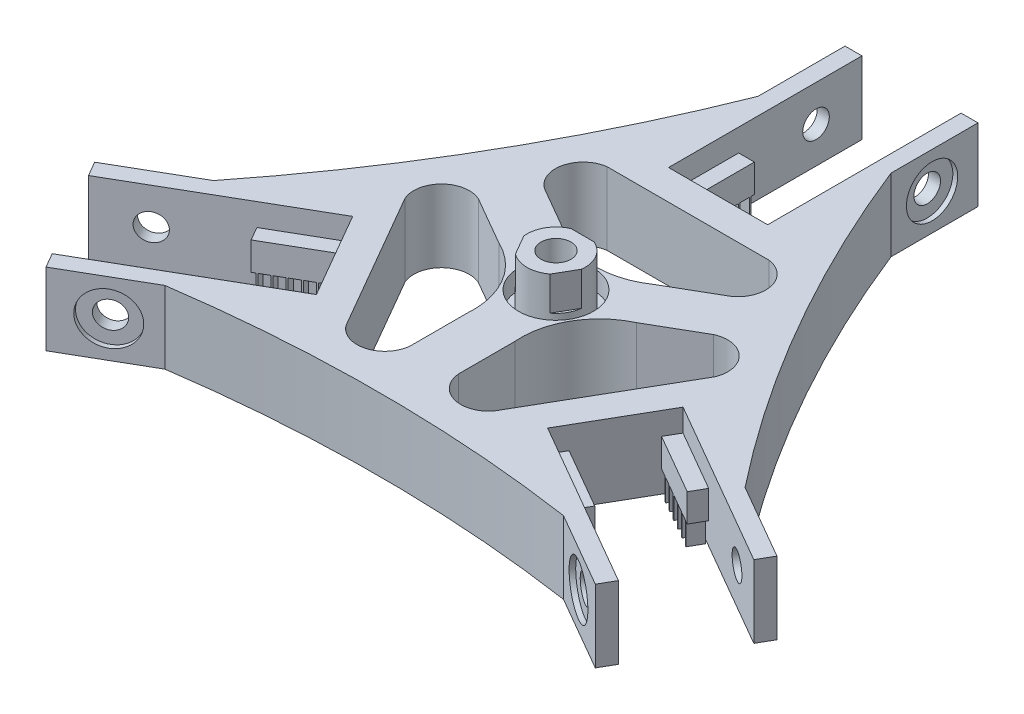
from build123d import *
from OCP.BRepAlgoAPI import BRepAlgoAPI_Cut
from OCP.TopTools import TopTools_ListOfShape

# Parameters (mm, degrees)
BOSS_EXTRUDE1_DEPTH          = 15
CUT_EXTRUDE2_DEPTH           = 38
SKETCH10_W                   = 20.5
SKETCH10_H                   = 27.012323029
CUT_EXTRUDE3_DEPTH           = 40
SKETCH15_R                   = 2.75
CUT_EXTRUDE5_DEPTH           = 40
SKETCH16_R                   = 5.3
CUT_EXTRUDE6_DEPTH           = 40
CIRPATTERN3_COUNT            = 3
CIRPATTERN3_COPY_1_SKETCH_R  = 5.3
CIRPATTERN3_COPY_1_DEPTH     = 40
CIRPATTERN3_COPY_2_SKETCH_R  = 5.3
CIRPATTERN3_COPY_2_DEPTH     = 40
CUT_EXTRUDE7_DEPTH           = 15
SKETCH21_R                   = 3.1
CUT_EXTRUDE8_DEPTH           = 40
BOSS_EXTRUDE2_DEPTH          = 7
CUT_EXTRUDE13_START          = -15
SKETCH27_R                   = 3.1
CUT_EXTRUDE13_DEPTH          = 15
ESQUISSE7_W                  = 2.95
ESQUISSE7_H                  = 0.3
BOSS_EXTRU_9_DEPTH           = 4.55
ESQUISSE8_W                  = 3.50000073
ESQUISSE8_H                  = 2
ESQUISSE8_W_2                = 3.5
BOSS_EXTRU_10_DEPTH          = 15
R_P_TITION_CIRCULAIRE2_DEPTH = 15
ENL_V_START                  = -4
ESQUISSE15_R                 = 7.75
ESQUISSE15_R_2               = 6
ENL_V_MAT_EXTRU_1_DEPTH      = 4
BOSS_EXTRU_11_DEPTH          = 15
ENL_V_START_2                = -15
ENL_V_MAT_EXTRU_2_DEPTH      = 15


with BuildPart() as part:
    # Sketch1 → Boss-Extrude1 (new body)
    with BuildSketch(Plane(origin=(0, 0, 0), x_dir=(1, 0, 0), z_dir=(0, 1, 0))):
        Polygon((-21.797006273, 71.528511607), (-72.844011657, -16.887495292), (-51.047006273, -54.64101607), (51.047004495, -54.64101607), (72.844009878, -16.887495292), (21.797004495, 71.528511607), align=None)
    extrude(amount=BOSS_EXTRUDE1_DEPTH)

    # Sketch5 → Cut-Extrude2 (cut)
    with BuildSketch(Plane(origin=(0, 0, -71.528511607), x_dir=(-1, 0, 0), z_dir=(0, 0, -1))):
        Polygon((7.000000889, 10.35), (10.250000889, 10.35), (10.250000889, 16.19707375), (-10.249999111, 16.19707375), (-10.249999111, 10.35), (-6.999999111, 10.35), (-6.999999111, 4.55), (-10.249999111, 4.55), (-10.249999111, -0.875434666), (10.250000889, -0.875434666), (10.250000889, 4.55), (7.000000889, 4.55), align=None)
    cut_extrude2 = extrude(amount=-CUT_EXTRUDE2_DEPTH, mode=Mode.SUBTRACT)

    # Sketch10 → Cut-Extrude3 (cut)
    with BuildSketch(Plane(origin=(0, 15, 0), x_dir=(1, 0, 0), z_dir=(0, 1, 0))):
        with Locations((-8.89e-07, 61.534673122)):
            Rectangle(SKETCH10_W, SKETCH10_H)
    cut_extrude3 = extrude(amount=-CUT_EXTRUDE3_DEPTH, mode=Mode.SUBTRACT)

    # Sketch15 → Cut-Extrude5 (cut, symmetric)
    with BuildSketch(Plane(origin=(-10.250000889, 0, 0), x_dir=(0, 0, -1), z_dir=(1, 0, 0))):
        with Locations(Location((64.028511607, 7.5, 0), (0, 0, 90))):
            Circle(SKETCH15_R)
    cut_extrude5 = extrude(amount=CUT_EXTRUDE5_DEPTH, both=True, mode=Mode.SUBTRACT)

    # Sketch16 → Cut-Extrude6 (cut)
    with BuildSketch(Plane(origin=(-12.750000889, 0, 0), x_dir=(0, 0, -1), z_dir=(1, 0, 0))):
        with Locations((64.028511607, 7.5)):
            Circle(SKETCH16_R)
    cut_extrude6 = extrude(amount=-CUT_EXTRUDE6_DEPTH, mode=Mode.SUBTRACT)

    # Mirror1: Cut-Extrude6 across plane
    add(cut_extrude6.mirror(Plane(origin=(0, 0, 0), x_dir=(0, 0, 1), z_dir=(1, 0, 0))), mode=Mode.SUBTRACT)

    # CirPattern3: Cut-Extrude2, Cut-Extrude3, Cut-Extrude5, Cut-Extrude6 ×3 about axis
    cirpattern3_axis = Axis((0, 0, 0), (0, 1, 0))
    add([cut_extrude2.rotate(cirpattern3_axis, i * 360 / CIRPATTERN3_COUNT) for i in range(1, CIRPATTERN3_COUNT)], mode=Mode.SUBTRACT)
    add([cut_extrude3.rotate(cirpattern3_axis, i * 360 / CIRPATTERN3_COUNT) for i in range(1, CIRPATTERN3_COUNT)], mode=Mode.SUBTRACT)
    add([cut_extrude5.rotate(cirpattern3_axis, i * 360 / CIRPATTERN3_COUNT) for i in range(1, CIRPATTERN3_COUNT)], mode=Mode.SUBTRACT)
    add([cut_extrude6.rotate(cirpattern3_axis, i * 360 / CIRPATTERN3_COUNT) for i in range(1, CIRPATTERN3_COUNT)], mode=Mode.SUBTRACT)

    # CirPattern3 copy 1 sketch → CirPattern3 copy 1 (cut)
    with BuildSketch(Plane(origin=(-6.375000445, 0, -11.041824668), x_dir=(-0.8660254037844387, 0, 0.4999999999999998), z_dir=(0.4999999999999998, 0, 0.8660254037844387))):
        with Locations((64.028511607, -7.5)):
            Circle(CIRPATTERN3_COPY_1_SKETCH_R)
    extrude(amount=-CIRPATTERN3_COPY_1_DEPTH, mode=Mode.SUBTRACT)

    # CirPattern3 copy 2 sketch → CirPattern3 copy 2 (cut)
    with BuildSketch(Plane(origin=(-6.375000445, 0, 11.041824668), x_dir=(0.8660254037844384, 0, 0.5000000000000004), z_dir=(0.5000000000000004, 0, -0.8660254037844384))):
        with Locations((64.028511607, -7.5)):
            Circle(CIRPATTERN3_COPY_2_SKETCH_R)
    extrude(amount=-CIRPATTERN3_COPY_2_DEPTH, mode=Mode.SUBTRACT)

    # Sketch20 → Cut-Extrude7 (cut)
    with BuildSketch(Plane(origin=(0, 15, 0), x_dir=(1, 0, 0), z_dir=(0, 1, 0))):
        with BuildLine():
            Line((92.688017182, -6.554453562), (68.820508591, -23.856405731))
            Line((68.820508591, -23.856405731), (51.500000515, -13.856405731))
            ThreePointArc((51.500000515, -13.856405731), (26.977145445, 15.575262652), (13.749999111, 51.528511803))
            Line((13.749999111, 51.528511803), (13.749999111, 71.528511803))
            Line((13.749999111, 71.528511803), (65.825359206, 76.180863169))
            Line((65.825359206, 76.180863169), (92.688017182, -6.554453562))
        make_face()
        with BuildLine():
            Line((-68.820507872, -23.85640737), (-98.887242389, 18.916001701))
            Line((-98.887242389, 18.916001701), (-40.667685298, 83.547404286))
            Line((-40.667685298, 83.547404286), (-13.750000889, 71.528511607))
            Line((-13.750000889, 71.528511607), (-13.750000889, 51.528511607))
            ThreePointArc((-13.750000889, 51.528511607), (-26.97714585, 15.575261951), (-51.499999796, -13.85640737))
            Line((-51.499999796, -13.85640737), (-68.820507872, -23.85640737))
        make_face()
        with BuildLine():
            Line((-52.020331883, -76.992950725), (-55.070507702, -47.672105875))
            Line((-55.070507702, -47.672105875), (-37.749999626, -37.672105875))
            ThreePointArc((-37.749999626, -37.672105875), (4.05e-07, -31.150524603), (37.750000685, -37.672104433))
            Line((37.750000685, -37.672104433), (55.070508761, -47.672104433))
            Line((55.070508761, -47.672104433), (33.061883184, -95.09686487))
            Line((33.061883184, -95.09686487), (-52.020331883, -76.992950725))
        make_face()
    extrude(amount=-CUT_EXTRUDE7_DEPTH, mode=Mode.SUBTRACT)

    # Sketch21 → Cut-Extrude8 (cut)
    with BuildSketch(Plane(origin=(0, 15, 0), x_dir=(1, 0, 0), z_dir=(0, 1, 0))):
        with Locations(Location((0, 0, 0), (0, 0, 270))):
            Circle(SKETCH21_R)
    extrude(amount=-CUT_EXTRUDE8_DEPTH, mode=Mode.SUBTRACT)

    # Sketch26 → Boss-Extrude2 (add)
    with BuildSketch(Plane(origin=(0, 15, 0), x_dir=(1, 0, 0), z_dir=(0, 1, 0))):
        with BuildLine():
            Line((2.38344399, 5.506286838), (-2.38344399, 5.506286838))
            ThreePointArc((-2.38344399, 5.506286838), (-5.196152423, 3), (-5.960306278, -0.689020376))
            Line((-5.960306278, -0.689020376), (-3.576862288, -4.817266463))
            ThreePointArc((-3.576862288, -4.817266463), (0, -6), (3.576862288, -4.817266463))
            Line((3.576862288, -4.817266463), (5.960306278, -0.689020376))
            ThreePointArc((5.960306278, -0.689020376), (5.196152423, 3), (2.38344399, 5.506286838))
        make_face()
    extrude(amount=BOSS_EXTRUDE2_DEPTH)

    # Sketch27 → Cut-Extrude13 (cut)
    with BuildSketch(Plane.XZ.offset(-15).offset(CUT_EXTRUDE13_START)):
        with Locations(Location((0, 0, 0), (0, 0, 90))):
            Circle(SKETCH27_R)
    extrude(amount=CUT_EXTRUDE13_DEPTH, mode=Mode.SUBTRACT)

    # Esquisse7 → Boss.-Extru.9 (add)
    with BuildSketch(Plane.XZ.offset(-4.55)):
        with Locations((-8.475000889, -35.678511607)):
            Rectangle(ESQUISSE7_W, ESQUISSE7_H)
        with Locations((-8.475000889, -37.978511607)):
            Rectangle(ESQUISSE7_W, ESQUISSE7_H)
        with Locations((-8.475000889, -40.278511607)):
            Rectangle(ESQUISSE7_W, ESQUISSE7_H)
        with Locations((-8.475000889, -42.578511607)):
            Rectangle(ESQUISSE7_W, ESQUISSE7_H)
        with Locations((-8.475000889, -44.878511607)):
            Rectangle(ESQUISSE7_W, ESQUISSE7_H)
        with Locations((-8.475000889, -47.178511607)):
            Rectangle(ESQUISSE7_W, ESQUISSE7_H)
        with Locations((8.475000889, -47.178511607)):
            Rectangle(ESQUISSE7_W, ESQUISSE7_H)
        with Locations((8.475000889, -44.878511607)):
            Rectangle(ESQUISSE7_W, ESQUISSE7_H)
        with Locations((8.475000889, -42.578511607)):
            Rectangle(ESQUISSE7_W, ESQUISSE7_H)
        with Locations((8.475000889, -40.278511607)):
            Rectangle(ESQUISSE7_W, ESQUISSE7_H)
        with Locations((8.475000889, -37.978511607)):
            Rectangle(ESQUISSE7_W, ESQUISSE7_H)
        with Locations((8.475000889, -35.678511607)):
            Rectangle(ESQUISSE7_W, ESQUISSE7_H)
        Polygon((-25.793593165, 26.381209341), (-27.268593165, 23.8264344), (-27.528400786, 23.9764344), (-26.053400786, 26.531209341), align=None)
        Polygon((-27.785451594, 27.531209341), (-28.045259215, 27.681209341), (-29.520259215, 25.1264344), (-29.260451594, 24.9764344), align=None)
        Polygon((-29.777310023, 28.681209341), (-30.037117644, 28.831209341), (-31.512117644, 26.2764344), (-31.252310023, 26.1264344), align=None)
        Polygon((-31.769168451, 29.831209341), (-32.028976073, 29.981209341), (-33.503976073, 27.4264344), (-33.244168451, 27.2764344), align=None)
        Polygon((-33.76102688, 30.981209341), (-34.020834501, 31.131209341), (-35.495834501, 28.5764344), (-35.23602688, 28.4264344), align=None)
        Polygon((-35.752885309, 32.131209341), (-36.01269293, 32.281209341), (-37.48769293, 29.7264344), (-37.227885309, 29.5764344), align=None)
        Polygon((-44.227886198, 17.452077207), (-44.487693819, 17.602077207), (-45.962693819, 15.047302266), (-45.702886198, 14.897302266), align=None)
        Polygon((-42.236027769, 16.302077207), (-42.495835391, 16.452077207), (-43.970835391, 13.897302266), (-43.711027769, 13.747302266), align=None)
        Polygon((-40.244169341, 15.152077207), (-40.503976962, 15.302077207), (-41.978976962, 12.747302266), (-41.719169341, 12.597302266), align=None)
        Polygon((-38.252310912, 14.002077207), (-38.512118533, 14.152077207), (-39.987118533, 11.597302266), (-39.727310912, 11.447302266), align=None)
        Polygon((-36.260452483, 12.852077207), (-36.520260104, 13.002077207), (-37.995260104, 10.447302266), (-37.735452483, 10.297302266), align=None)
        Polygon((-34.268594055, 11.702077207), (-34.528401676, 11.852077207), (-36.003401676, 9.297302266), (-35.743594055, 9.147302266), align=None)
        Polygon((35.743594055, 9.147302266), (34.268594055, 11.702077207), (34.528401676, 11.852077207), (36.003401676, 9.297302266), align=None)
        Polygon((37.735452483, 10.297302266), (37.995260104, 10.447302266), (36.520260104, 13.002077207), (36.260452483, 12.852077207), align=None)
        Polygon((39.727310912, 11.447302266), (39.987118533, 11.597302266), (38.512118533, 14.152077207), (38.252310912, 14.002077207), align=None)
        Polygon((41.719169341, 12.597302266), (41.978976962, 12.747302266), (40.503976962, 15.302077207), (40.244169341, 15.152077207), align=None)
        Polygon((43.711027769, 13.747302266), (43.970835391, 13.897302266), (42.495835391, 16.452077207), (42.236027769, 16.302077207), align=None)
        Polygon((45.702886198, 14.897302266), (45.962693819, 15.047302266), (44.487693819, 17.602077207), (44.227886198, 17.452077207), align=None)
        Polygon((37.227885309, 29.5764344), (37.48769293, 29.7264344), (36.01269293, 32.281209341), (35.752885309, 32.131209341), align=None)
        Polygon((35.23602688, 28.4264344), (35.495834501, 28.5764344), (34.020834501, 31.131209341), (33.76102688, 30.981209341), align=None)
        Polygon((33.244168451, 27.2764344), (33.503976073, 27.4264344), (32.028976073, 29.981209341), (31.769168451, 29.831209341), align=None)
        Polygon((31.252310023, 26.1264344), (31.512117644, 26.2764344), (30.037117644, 28.831209341), (29.777310023, 28.681209341), align=None)
        Polygon((29.260451594, 24.9764344), (29.520259215, 25.1264344), (28.045259215, 27.681209341), (27.785451594, 27.531209341), align=None)
        Polygon((27.268593165, 23.8264344), (27.528400786, 23.9764344), (26.053400786, 26.531209341), (25.793593165, 26.381209341), align=None)
    extrude(amount=BOSS_EXTRU_9_DEPTH)

    # Esquisse8 → Boss.-Extru.10 (add)
    with BuildSketch(Plane(origin=(0, 15, 0), x_dir=(1, 0, 0), z_dir=(0, 1, 0))):
        with Locations((11.999998746, 72.528511803)):
            Rectangle(ESQUISSE8_W, ESQUISSE8_H)
        with Locations((-12.000000889, 72.528511607)):
            Rectangle(ESQUISSE8_W_2, ESQUISSE8_H)
    extrude(amount=-BOSS_EXTRU_10_DEPTH)


with BuildPart() as r_p_tition_circulaire2_tool:
    # Répétition circulaire2: read off the stored shape, not the designer's step
    # Répétition circulaire2 outline → Répétition circulaire2 (new body)
    with BuildSketch(Plane(origin=(0, 0, 0), x_dir=(1, 0, 0), z_dir=(0, 1, 0))):
        Polygon((-68.820508067, -23.856407483), (-70.552558679, -24.85640737), (-68.802558314, -27.887496915), (-67.070507982, -26.887496347), align=None)
        Polygon((-56.820507982, -44.641017124), (-58.552558509, -45.641016962), (-56.802558509, -48.672105875), (-55.070507982, -47.672106037), align=None)
        Polygon((55.070508289, -47.672104161), (56.802559568, -48.672104433), (58.552559934, -45.641014888), (56.820508204, -44.641015199), align=None)
        Polygon((67.070508204, -26.887494421), (68.802559398, -27.887494644), (70.552559398, -24.856405731), (68.820508204, -23.856405508), align=None)
    extrude(amount=R_P_TITION_CIRCULAIRE2_DEPTH)


with BuildPart() as part_1:
    add(part.part)


with BuildPart() as part_2:
    # Répétition circulaire2: joined with r_p_tition_circulaire2_tool
    add(part_1.part.fuse(r_p_tition_circulaire2_tool.part, tol=0.00001))

    # Esquisse15 → Enlèv. mat.-Extru.1 (cut)
    with BuildSketch(Plane(origin=(0, 15, 0), x_dir=(1, 0, 0), z_dir=(0, 1, 0)).offset(ENL_V_START)):
        with Locations(Location((0, 0, 0), (0, 0, 270))):
            Circle(ESQUISSE15_R)
        with Locations(Location((0, 0, 0), (0, 0, 66.594207935))):
            Circle(ESQUISSE15_R_2, mode=Mode.SUBTRACT)
    extrude(amount=ENL_V_MAT_EXTRU_1_DEPTH, mode=Mode.SUBTRACT)

    # Esquisse16 → Boss.-Extru.11 (add)
    with BuildSketch(Plane(origin=(0, 15, 0), x_dir=(1, 0, 0), z_dir=(0, 1, 0))):
        with BuildLine():
            ThreePointArc((13.749999111, 51.528511803), (26.977145445, 15.575262652), (51.500000515, -13.856405731))
            Line((51.500000515, -13.856405731), (54.964102245, -15.856405797))
            Line((54.964102245, -15.856405797), (13.749999111, 55.528511671))
            Line((13.749999111, 55.528511671), (13.749999111, 51.528511803))
        make_face()
        with BuildLine():
            Line((-13.750000889, 51.528511607), (-13.750000889, 55.528511739))
            Line((-13.750000889, 55.528511739), (-54.964101296, -15.856407303))
            Line((-54.964101296, -15.856407303), (-51.499999796, -13.85640737))
            ThreePointArc((-51.499999796, -13.85640737), (-26.97714585, 15.575261951), (-13.750000889, 51.528511607))
        make_face()
        with BuildLine():
            ThreePointArc((37.750000685, -37.672104433), (4.05e-07, -31.150524603), (-37.749999626, -37.672105875))
            Line((-37.749999626, -37.672105875), (-41.214101356, -39.672105942))
            Line((-41.214101356, -39.672105942), (41.214102186, -39.672104367))
            Line((41.214102186, -39.672104367), (37.750000685, -37.672104433))
        make_face()
    extrude(amount=-BOSS_EXTRU_11_DEPTH)


with BuildPart() as enl_v_mat_extru_2_tool:
    # Enlèv. mat.-Extru.2: read off the stored shape, not the designer's step
    # Enlèv. mat.-Extru.2 outline → Enlèv. mat.-Extru.2 (new body)
    with BuildSketch(Plane(origin=(0, 15, 0), x_dir=(1, 0, 0), z_dir=(0, 1, 0)).offset(ENL_V_START_2)):
        with BuildLine():
            Line((15.293738513, -28.153880503), (32.028844987, 0.83217418))
            ThreePointArc((32.028844987, 0.83217418), (30.704453712, 7.185917337), (24.303308362, 8.258019274))
            Line((24.303308362, 8.258019274), (14.211696643, 2.431624152))
            ThreePointArc((14.211696643, 2.431624152), (7.105848219, -4.102563382), (5.000000033, -13.5235024))
            Line((5.000000033, -13.5235024), (4.999999705, -25.176292075))
            ThreePointArc((4.999999705, -25.176292075), (9.129039893, -30.183795592), (15.293738513, -28.153880503))
        make_face()
        with BuildLine():
            Line((-32.028844987, 0.83217418), (-15.293738513, -28.153880503))
            ThreePointArc((-15.293738513, -28.153880503), (-9.129039893, -30.183795592), (-4.999999705, -25.176292075))
            Line((-4.999999705, -25.176292075), (-5.000000033, -13.5235024))
            ThreePointArc((-5.000000033, -13.5235024), (-7.105848219, -4.102563382), (-14.211696643, 2.431624152))
            Line((-14.211696643, 2.431624152), (-24.303308362, 8.258019274))
            ThreePointArc((-24.303308362, 8.258019274), (-30.704453712, 7.185917337), (-32.028844987, 0.83217418))
        make_face()
        with BuildLine():
            Line((-41.21410152, -39.672104818), (41.214104849, -39.672104404))
            ThreePointArc((41.214104849, -39.672104404), (1.649e-06, -36.672104404), (-41.21410152, -39.672104818))
        make_face()
        with BuildLine():
            Line((16.735106474, 27.321706323), (-16.735106474, 27.321706323))
            ThreePointArc((-16.735106474, 27.321706323), (-21.575413819, 22.997878256), (-19.303308658, 16.918272801))
            Line((-19.303308658, 16.918272801), (-9.21169661, 11.091878248))
            ThreePointArc((-9.21169661, 11.091878248), (0, 8.205126764), (9.21169661, 11.091878248))
            Line((9.21169661, 11.091878248), (19.303308658, 16.918272801))
            ThreePointArc((19.303308658, 16.918272801), (21.575413819, 22.997878256), (16.735106474, 27.321706323))
        make_face()
        with BuildLine():
            Line((-13.749999834, 55.528511319), (-54.96410266, -15.856409591))
            ThreePointArc((-54.96410266, -15.856409591), (-31.758974849, 18.336050774), (-13.749999834, 55.528511319))
        make_face()
        with BuildLine():
            Line((54.964101354, -15.856406502), (13.749997811, 55.528513995))
            ThreePointArc((13.749997811, 55.528513995), (31.758973199, 18.33605363), (54.964101354, -15.856406502))
        make_face()
    extrude(amount=ENL_V_MAT_EXTRU_2_DEPTH)


with BuildPart() as part_3:
    add(part_2.part)

    # Enlèv. mat.-Extru.2: cut by enl_v_mat_extru_2_tool, with a tolerance
    enl_v_mat_extru_2_stock = TopTools_ListOfShape()
    enl_v_mat_extru_2_stock.Append(part_3.part.wrapped)
    enl_v_mat_extru_2_tools = TopTools_ListOfShape()
    enl_v_mat_extru_2_tools.Append(enl_v_mat_extru_2_tool.part.wrapped)
    enl_v_mat_extru_2_cut = BRepAlgoAPI_Cut()
    enl_v_mat_extru_2_cut.SetArguments(enl_v_mat_extru_2_stock)
    enl_v_mat_extru_2_cut.SetTools(enl_v_mat_extru_2_tools)
    enl_v_mat_extru_2_cut.SetFuzzyValue(0.00001)
    enl_v_mat_extru_2_cut.Build()
    add(Compound.cast(enl_v_mat_extru_2_cut.Shape()).solids(), mode=Mode.REPLACE)


solid = part_3.part
